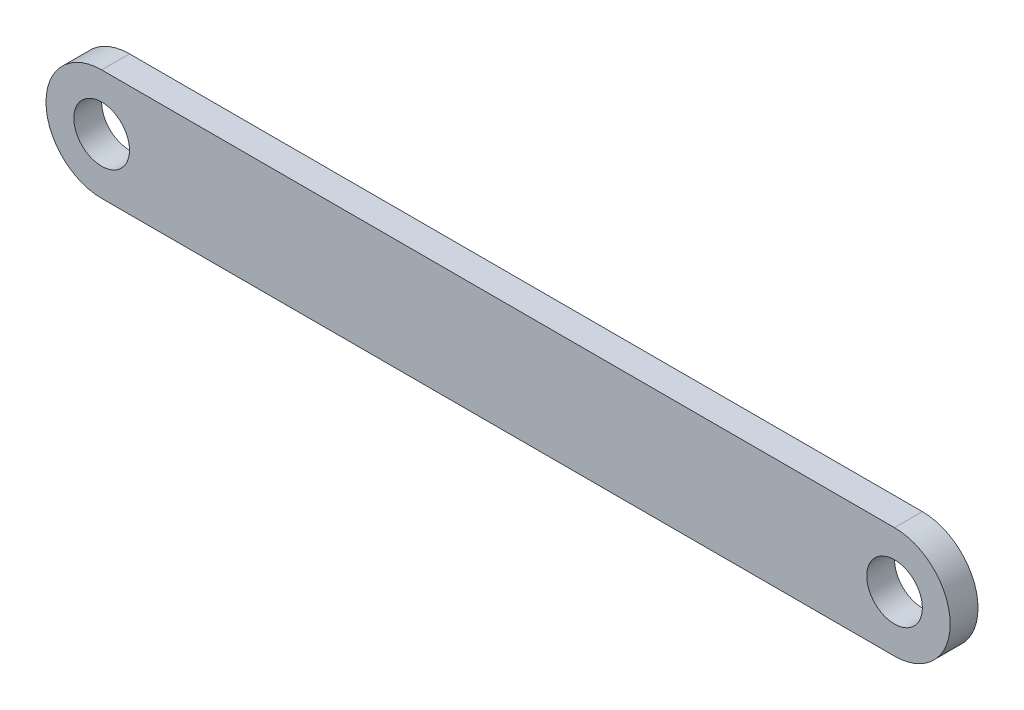
from build123d import *

# Parameters (mm, degrees)
SKETCH_1_R      = 1
EXTRUDE_1_DEPTH = 0.5


with BuildPart() as part:
    # Эскиз1 → Бобышка-Вытянуть1 (new, symmetric)
    with BuildSketch(Plane.XY):
        with BuildLine():
            Line((0, 2), (-28.5003, 2))
            ThreePointArc((-28.5003, 2), (-30.5003, 0), (-28.5003, -2))
            Line((-28.5003, -2), (0, -2))
            ThreePointArc((0, -2), (2, 0), (0, 2))
        make_face()
        with Locations((-28.5003, 0)):
            Circle(SKETCH_1_R, mode=Mode.SUBTRACT)
        Circle(SKETCH_1_R, mode=Mode.SUBTRACT)
    extrude(amount=EXTRUDE_1_DEPTH, both=True)


solid = part.part
